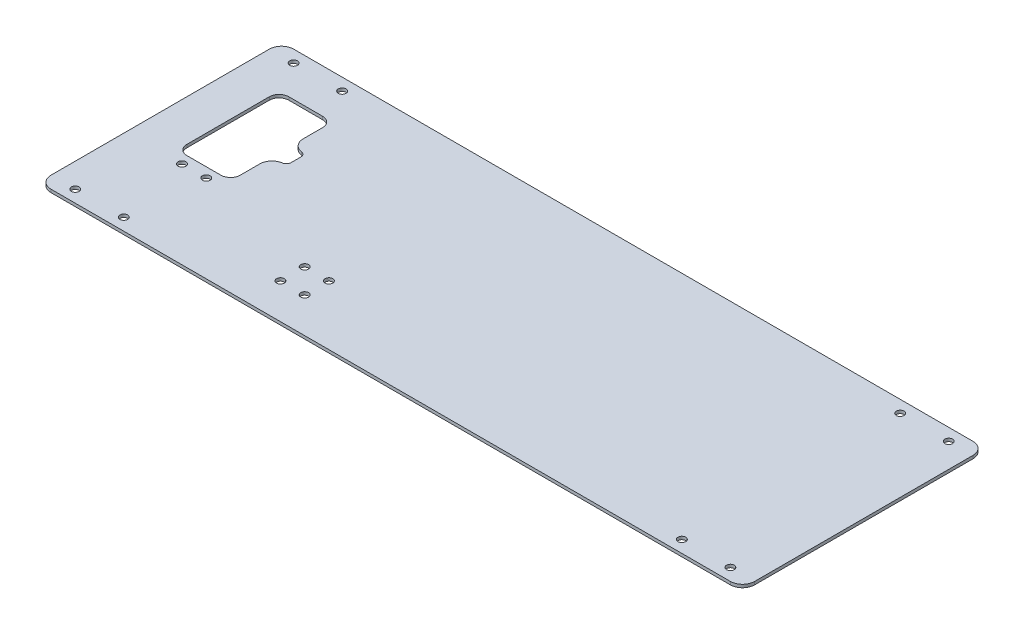
from build123d import *

# Parameters (mm, degrees)
SKETCH1_W           = 368.3
SKETCH1_H           = 127
SKETCH1_R           = 2.032
BOSS_EXTRUDE1_DEPTH = 1.5875
FILLET1_R           = 5.08
FILLET3_R           = 6.35
FILLET4_R           = 2.54
FILLET5_R           = 6.35


with BuildPart() as part:
    # Sketch1 → Boss-Extrude1 (new body)
    with BuildSketch(Plane(origin=(0, 0, 0), x_dir=(1, 0, 0), z_dir=(0, 1, 0))):
        Rectangle(SKETCH1_W, SKETCH1_H)
        with Locations((-171.45, -57.15)):
            Circle(SKETCH1_R, mode=Mode.SUBTRACT)
        with Locations((-146.05, -57.15)):
            Circle(SKETCH1_R, mode=Mode.SUBTRACT)
        with Locations((-76.2, -45.0215)):
            Circle(SKETCH1_R, mode=Mode.SUBTRACT)
        with Locations((-63.5, -45.0215)):
            Circle(SKETCH1_R, mode=Mode.SUBTRACT)
        with Locations((-76.2, -32.3215)):
            Circle(SKETCH1_R, mode=Mode.SUBTRACT)
        with Locations((-63.5, -32.3215)):
            Circle(SKETCH1_R, mode=Mode.SUBTRACT)
        with Locations((-154.94, -17.78)):
            Circle(SKETCH1_R, mode=Mode.SUBTRACT)
        with Locations((-142.24, -17.78)):
            Circle(SKETCH1_R, mode=Mode.SUBTRACT)
        with Locations((146.05, -57.15)):
            Circle(SKETCH1_R, mode=Mode.SUBTRACT)
        with Locations((171.45, -57.15)):
            Circle(SKETCH1_R, mode=Mode.SUBTRACT)
        Polygon((-134.62, -12.7), (-162.56, -12.7), (-162.56, 40.64), (-134.62, 40.64), (-134.62, 19.05), (-127, 19.05), (-127, 8.89), (-134.62, 8.89), align=None, mode=Mode.SUBTRACT)
        with Locations((-171.45, 57.15)):
            Circle(SKETCH1_R, mode=Mode.SUBTRACT)
        with Locations((-146.05, 57.15)):
            Circle(SKETCH1_R, mode=Mode.SUBTRACT)
        with Locations((146.05, 57.15)):
            Circle(SKETCH1_R, mode=Mode.SUBTRACT)
        with Locations((171.45, 57.15)):
            Circle(SKETCH1_R, mode=Mode.SUBTRACT)
    extrude(amount=BOSS_EXTRUDE1_DEPTH)

    # Fillet1
    fillet1_edges = [part.edges().sort_by_distance(p)[0] for p in [
        (-134.62, 0.79375, 12.7),
        (-162.56, 0.79375, 12.7),
        (-162.56, 0.79375, -40.64),
        (-134.62, 0.79375, -40.64),
    ]]
    fillet(fillet1_edges, radius=FILLET1_R)

    # Fillet3
    fillet3_edges = [part.edges().sort_by_distance(p)[0] for p in [
        (184.15, 0.79375, 63.5),
        (184.15, 0.79375, -63.5),
        (-184.15, 0.79375, 63.5),
        (-184.15, 0.79375, -63.5),
    ]]
    fillet(fillet3_edges, radius=FILLET3_R)

    # Fillet4
    fillet4_edges = [part.edges().sort_by_distance(p)[0] for p in [
        (-127, 0.79375, -8.89),
        (-127, 0.79375, -19.05),
    ]]
    fillet(fillet4_edges, radius=FILLET4_R)

    # Fillet5
    fillet5_edges = [part.edges().sort_by_distance(p)[0] for p in [
        (-134.62, 0.79375, -8.89),
        (-134.62, 0.79375, -19.05),
    ]]
    fillet(fillet5_edges, radius=FILLET5_R)


solid = part.part
